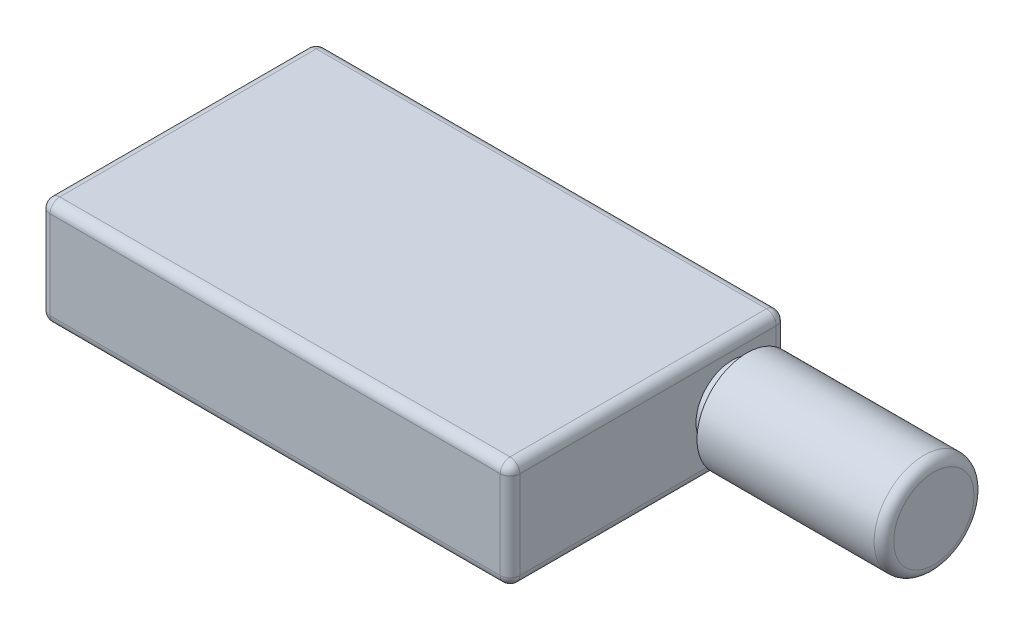
from build123d import *

# Parameters (mm, degrees)
SKETCH1_W           = 48
SKETCH1_H           = 28.2
BOSS_EXTRUDE1_DEPTH = 11
SKETCH2_R           = 3.7
BOSS_EXTRUDE2_DEPTH = 1.5
SKETCH3_R           = 5.1
BOSS_EXTRUDE3_DEPTH = 19.1
FILLET1_R           = 1
FILLET2_R           = 1
FILLET3_R           = 1


with BuildPart() as part:
    # Sketch1 → Boss-Extrude1 (new body)
    with BuildSketch(Plane(origin=(0, 0, 0), x_dir=(1, 0, 0), z_dir=(0, 1, 0))):
        with Locations((24, 14.1)):
            Rectangle(SKETCH1_W, SKETCH1_H)
    extrude(amount=BOSS_EXTRUDE1_DEPTH)

    # Sketch2 → Boss-Extrude2 (add)
    with BuildSketch(Plane(origin=(48, 0, 0), x_dir=(0, 0, -1), z_dir=(1, 0, 0))):
        with Locations((22.7, 5.5)):
            Circle(SKETCH2_R)
    extrude(amount=BOSS_EXTRUDE2_DEPTH)

    # Sketch3 → Boss-Extrude3 (add)
    with BuildSketch(Plane(origin=(49.5, 0, 0), x_dir=(0, 0, -1), z_dir=(1, 0, 0))):
        with Locations((22.7, 5.5)):
            Circle(SKETCH3_R)
    extrude(amount=BOSS_EXTRUDE3_DEPTH)

    # Fillet1
    fillet1_edges = [part.edges().sort_by_distance(p)[0] for p in [
        (48, 0, -14.1),
        (48, 5.5, -28.2),
        (24, 0, -28.2),
        (0, 5.5, -28.2),
        (0, 0, -14.1),
        (0, 5.5, 0),
        (48, 5.5, 0),
        (24, 0, 0),
        (24, 11, -28.2),
        (48, 11, -14.1),
        (24, 11, 0),
        (0, 11, -14.1),
    ]]
    fillet(fillet1_edges, radius=FILLET1_R)

    # Fillet2
    fillet2_edges = [part.edges().sort_by_distance(p)[0] for p in [
        (68.6, 5.5, -17.6),
    ]]
    fillet(fillet2_edges, radius=FILLET2_R)

    # Fillet3
    fillet3_edges = [part.edges().sort_by_distance(p)[0] for p in [
        (49.5, 5.5, -19),
    ]]
    fillet(fillet3_edges, radius=FILLET3_R)


solid = part.part
